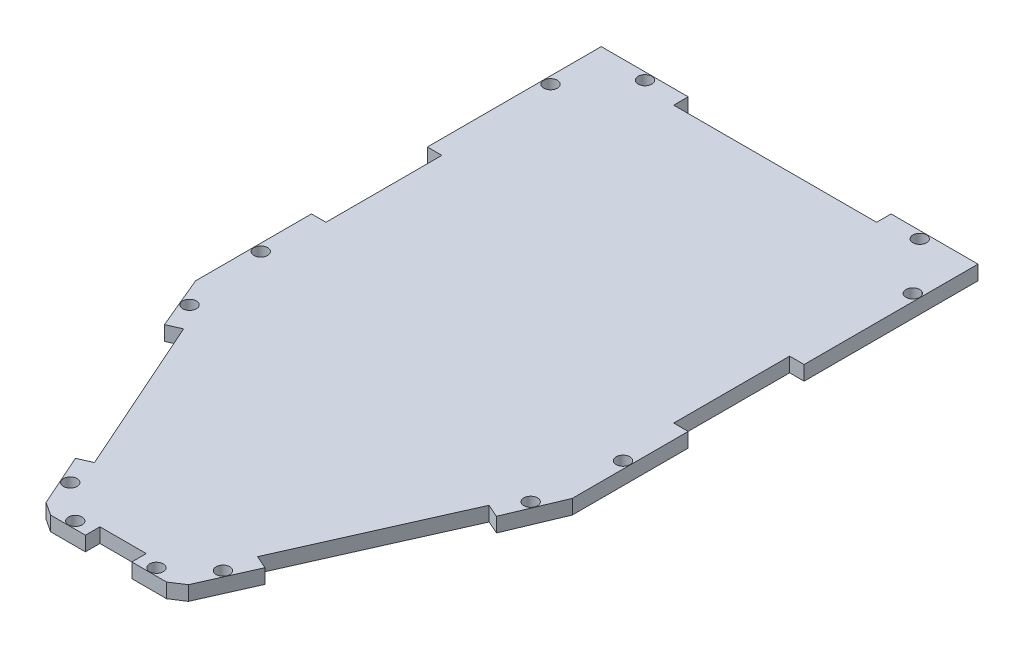
from build123d import *

# Parameters (mm, degrees)
BOSS_EXTRUDE1_DEPTH = 3.175
SKETCH2_R           = 1.5
SKETCH2_R_2         = 1.500000048
CUT_EXTRUDE1_DEPTH  = 99.065877093
SKETCH3_R           = 1.500000048
CUT_EXTRUDE2_DEPTH  = 99.065877093


with BuildPart() as part:
    # Sketch1 → Boss-Extrude1 (new body)
    with BuildSketch(Plane(origin=(0, 0, 0), x_dir=(1, 0, 0), z_dir=(0, 1, 0))):
        Polygon((-41.275, 0), (-36.368301991, -11.713851401), (-33.466950324, -10.424361771), (-17.857958519, -45.544593333), (-20.759310186, -46.834082962), (-15.601351667, -58.43948963), (-12.7, -60.325), (-5.08, -60.325), (-5.08, -57.15), (5.08, -57.15), (5.08, -60.325), (12.7, -60.325), (15.601351667, -58.43948963), (20.759310186, -46.834082962), (17.857958519, -45.544593333), (33.466950324, -10.424361771), (36.368301991, -11.713851401), (41.275, 0), (41.275, 25.4), (38.1, 25.4), (38.1, 50.8), (41.275, 50.8), (41.275, 88.9), (22.225, 88.9), (22.225, 85.725), (-22.225, 85.725), (-22.225, 88.9), (-41.275, 88.9), (-41.275, 50.8), (-38.1, 50.8), (-38.1, 25.4), (-41.275, 25.4), align=None)
    extrude(amount=BOSS_EXTRUDE1_DEPTH)

    # Sketch2 → Cut-Extrude1 (cut, through all)
    with BuildSketch(Plane(origin=(0, 0, 0), x_dir=(-1, 0, 0), z_dir=(0, -1, 0))):
        with Locations((39.6875, 76.2)):
            Circle(SKETCH2_R)
        with Locations((-8.89, -58.7375)):
            Circle(SKETCH2_R_2)
        with Locations((39.6875, 12.7)):
            Circle(SKETCH2_R_2)
        with Locations((37.371544878, -5.210820791)):
            Circle(SKETCH2_R_2)
        with Locations((16.729655093, -51.992041481)):
            Circle(SKETCH2_R_2)
        with Locations((8.89, -58.7375)):
            Circle(SKETCH2_R_2)
        with Locations((-16.729655093, -51.992041481)):
            Circle(SKETCH2_R_2)
        with Locations((-37.371544878, -5.210820791)):
            Circle(SKETCH2_R_2)
        with Locations((-39.6875, 12.7)):
            Circle(SKETCH2_R_2)
        with Locations((-39.6875, 76.2)):
            Circle(SKETCH2_R)
    extrude(amount=-CUT_EXTRUDE1_DEPTH, mode=Mode.SUBTRACT)

    # Sketch3 → Cut-Extrude2 (cut, through all)
    with BuildSketch(Plane.XZ):
        with Locations((-30.099, -87.3125)):
            Circle(SKETCH3_R)
        with Locations((30.099, -87.3125)):
            Circle(SKETCH3_R)
    extrude(amount=-CUT_EXTRUDE2_DEPTH, mode=Mode.SUBTRACT)


solid = part.part
